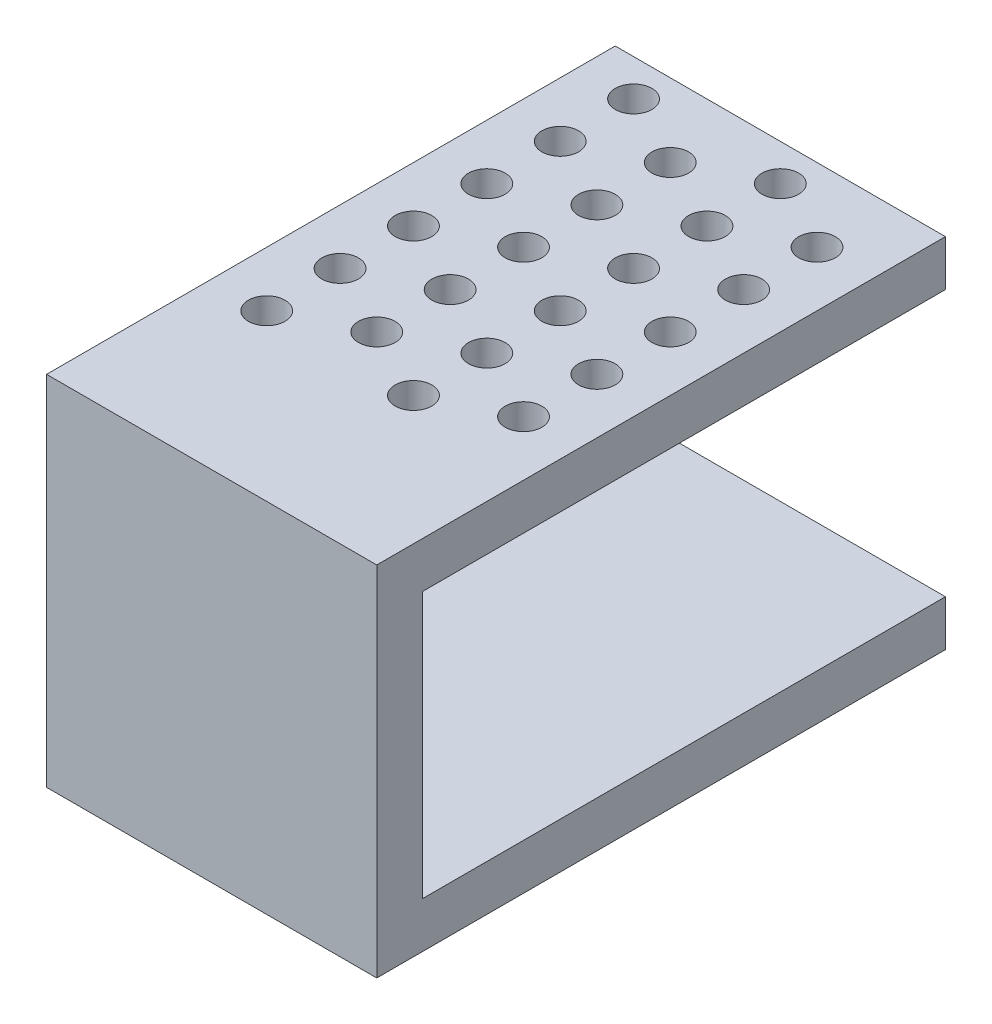
from build123d import *

# Parameters (mm, degrees)
SKETCH2_W           = 18
SKETCH2_H           = 24
SKETCH2_R           = 1
BOSS_EXTRUDE2_DEPTH = 2.5
SKETCH3_W           = 18
SKETCH3_H           = 2.5
BOSS_EXTRUDE3_DEPTH = 7
SKETCH4_W           = 18
SKETCH4_H           = 2.5
BOSS_EXTRUDE4_DEPTH = 17
SKETCH5_W           = 18
SKETCH5_H           = 2.5
BOSS_EXTRUDE5_DEPTH = 28.5


with BuildPart() as part:
    # Sketch2 → Boss-Extrude2 (new body)
    with BuildSketch(Plane(origin=(0, 0, 0), x_dir=(1, 0, 0), z_dir=(0, 1, 0))):
        with Locations((-11, 4)):
            Rectangle(SKETCH2_W, SKETCH2_H)
        with Locations((-17, -6)):
            Circle(SKETCH2_R, mode=Mode.SUBTRACT)
        with Locations((-17, -2)):
            Circle(SKETCH2_R, mode=Mode.SUBTRACT)
        with Locations((-17, 2)):
            Circle(SKETCH2_R, mode=Mode.SUBTRACT)
        with Locations((-17, 6)):
            Circle(SKETCH2_R, mode=Mode.SUBTRACT)
        with Locations((-17, 10)):
            Circle(SKETCH2_R, mode=Mode.SUBTRACT)
        with Locations((-17, 14)):
            Circle(SKETCH2_R, mode=Mode.SUBTRACT)
        with Locations((-13, -4)):
            Circle(SKETCH2_R, mode=Mode.SUBTRACT)
        with Locations((-13, 0)):
            Circle(SKETCH2_R, mode=Mode.SUBTRACT)
        with Locations((-13, 4)):
            Circle(SKETCH2_R, mode=Mode.SUBTRACT)
        with Locations((-13, 8)):
            Circle(SKETCH2_R, mode=Mode.SUBTRACT)
        with Locations((-13, 12)):
            Circle(SKETCH2_R, mode=Mode.SUBTRACT)
        with Locations((-9, -6)):
            Circle(SKETCH2_R, mode=Mode.SUBTRACT)
        with Locations((-9, -2)):
            Circle(SKETCH2_R, mode=Mode.SUBTRACT)
        with Locations((-9, 2)):
            Circle(SKETCH2_R, mode=Mode.SUBTRACT)
        with Locations((-9, 6)):
            Circle(SKETCH2_R, mode=Mode.SUBTRACT)
        with Locations((-9, 10)):
            Circle(SKETCH2_R, mode=Mode.SUBTRACT)
        with Locations((-9, 14)):
            Circle(SKETCH2_R, mode=Mode.SUBTRACT)
        with Locations((-5, -4)):
            Circle(SKETCH2_R, mode=Mode.SUBTRACT)
        with Locations((-5, 0)):
            Circle(SKETCH2_R, mode=Mode.SUBTRACT)
        with Locations((-5, 4)):
            Circle(SKETCH2_R, mode=Mode.SUBTRACT)
        with Locations((-5, 8)):
            Circle(SKETCH2_R, mode=Mode.SUBTRACT)
        with Locations((-5, 12)):
            Circle(SKETCH2_R, mode=Mode.SUBTRACT)
    extrude(amount=BOSS_EXTRUDE2_DEPTH)

    # Sketch3 → Boss-Extrude3 (add)
    with BuildSketch(Plane.XY.offset(8)):
        with Locations((-11, 1.25)):
            Rectangle(SKETCH3_W, SKETCH3_H)
    extrude(amount=BOSS_EXTRUDE3_DEPTH)

    # Sketch4 → Boss-Extrude4 (add)
    with BuildSketch(Plane(origin=(0, 0, 0), x_dir=(-1, 0, 0), z_dir=(0, -1, 0))):
        with Locations((11, -13.75)):
            Rectangle(SKETCH4_W, SKETCH4_H)
    extrude(amount=BOSS_EXTRUDE4_DEPTH)

    # Sketch5 → Boss-Extrude5 (add)
    with BuildSketch(Plane(origin=(0, 0, 12.5), x_dir=(-1, 0, 0), z_dir=(0, 0, -1))):
        with Locations((11, -15.75)):
            Rectangle(SKETCH5_W, SKETCH5_H)
    extrude(amount=BOSS_EXTRUDE5_DEPTH)


solid = part.part
